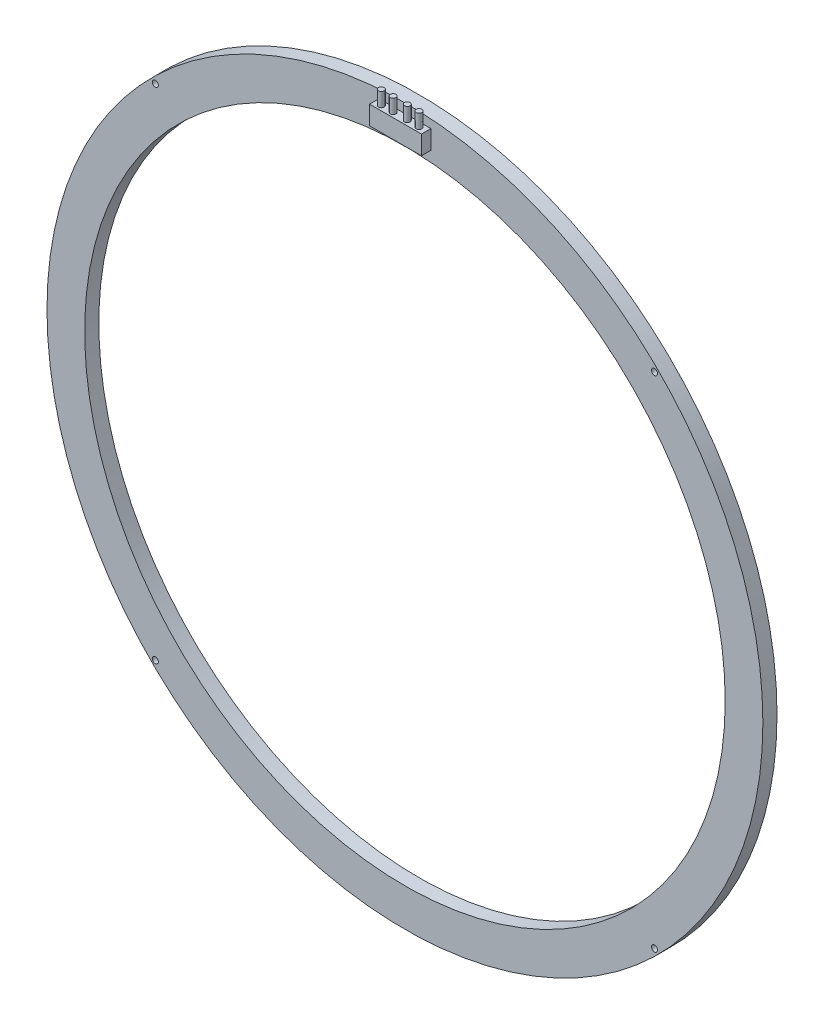
from build123d import *

# Parameters (mm, degrees)
EXTRUDE_1_OUTLINE_R   = 76
EXTRUDE_1_OUTLINE_R_2 = 0.65
EXTRUDE_1_OUTLINE_R_3 = 68
EXTRUDE_1_DEPTH       = 3
SKETCH_2_W            = 11
SKETCH_2_H            = 4
EXTRUDE_2_DEPTH       = 2
SKETCH_3_R            = 0.6
EXTRUDE_3_DEPTH       = 3


# Read off the part's stored shape, not the designer's step: 凸台-拉伸1
with BuildPart() as part:
    # 凸台-拉伸1 outline → 凸台-拉伸1 (new body)
    with BuildSketch(Plane.XY):
        Circle(EXTRUDE_1_OUTLINE_R)
        with Locations((-53, -53)):
            Circle(EXTRUDE_1_OUTLINE_R_2, mode=Mode.SUBTRACT)
        with Locations((53, -53)):
            Circle(EXTRUDE_1_OUTLINE_R_2, mode=Mode.SUBTRACT)
        with Locations((-53, 53)):
            Circle(EXTRUDE_1_OUTLINE_R_2, mode=Mode.SUBTRACT)
        Circle(EXTRUDE_1_OUTLINE_R_3, mode=Mode.SUBTRACT)
        with Locations((53, 53)):
            Circle(EXTRUDE_1_OUTLINE_R_2, mode=Mode.SUBTRACT)
    extrude(amount=EXTRUDE_1_DEPTH)

    # 草图2 → 凸台-拉伸2 (add)
    with BuildSketch(Plane.XY.offset(3)):
        with Locations((0, 72)):
            Rectangle(SKETCH_2_W, SKETCH_2_H)
    extrude(amount=EXTRUDE_2_DEPTH)

    # 草图3 → 凸台-拉伸3 (add)
    with BuildSketch(Plane(origin=(0, 74, 0), x_dir=(1, 0, 0), z_dir=(0, 1, 0))):
        with Locations(Location((-1.5, -4, 0), (0, 0, 90))):
            Circle(SKETCH_3_R)
        with Locations(Location((1.5, -4, 0), (0, 0, 90))):
            Circle(SKETCH_3_R)
        with Locations(Location((-4, -4, 0), (0, 0, 90))):
            Circle(SKETCH_3_R)
        with Locations(Location((4, -4, 0), (0, 0, 90))):
            Circle(SKETCH_3_R)
    extrude(amount=EXTRUDE_3_DEPTH)


solid = part.part
